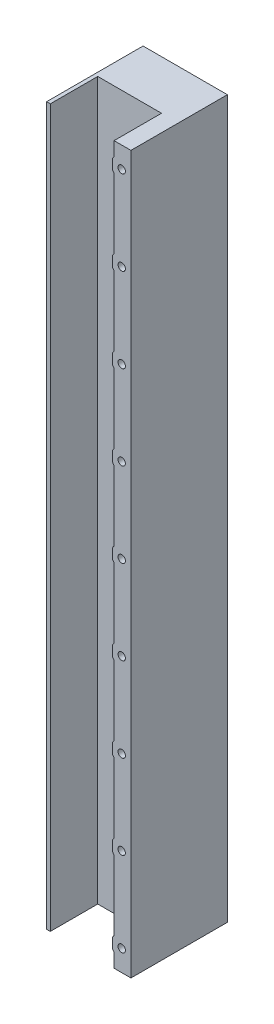
from build123d import *

# Parameters (mm, degrees)
PROFILE_SKETCH_W               = 16
PROFILE_SKETCH_H               = 18.3
PROFILE_EXTRUDE_DEPTH          = 136
POCKET_SKETCH_W                = 12.1
POCKET_SKETCH_H                = 9
POCKET_CUT_DEPTH               = 139.155311154
INDEX_HOLE_SKETCH_R            = 0.7
FIRST_INDEX_HOLE_CUT_DEPTH     = 8
INDEX_HOLE_REINFORCEMENT_REACH = 140.155
INDEX_HOLE_PATTERN_COUNT       = 9
INDEX_HOLE_PATTERN_PITCH       = 16


with BuildPart() as part:
    # Profile Sketch → Profile Extrude (new body)
    with BuildSketch(Plane(origin=(0.045617437, 0, -0.024209872), x_dir=(-1, 0, 0), z_dir=(0, 1, 0))):
        with Locations((8.045617437, -9.125790128)):
            Rectangle(PROFILE_SKETCH_W, PROFILE_SKETCH_H)
    extrude(amount=PROFILE_EXTRUDE_DEPTH)

    # Pocket Sketch → Pocket Cut (cut, through all)
    with BuildSketch(Plane(origin=(0, 0, 0), x_dir=(1, 0, 0), z_dir=(0, 1, 0))):
        with Locations((-9.25, 4.5)):
            Rectangle(POCKET_SKETCH_W, POCKET_SKETCH_H)
    extrude(amount=POCKET_CUT_DEPTH, mode=Mode.SUBTRACT)

    # Index Hole Sketch → First Index Hole Cut (cut)
    with BuildSketch(Plane.XY):
        with Locations((-1.75, 4)):
            Circle(INDEX_HOLE_SKETCH_R)
    first_index_hole_cut = extrude(amount=-FIRST_INDEX_HOLE_CUT_DEPTH, mode=Mode.SUBTRACT)

    # Index Hole Reinforcement Sketch → Index Hole Reinforcement (add, up to next)
    with BuildSketch(Plane.XY, mode=Mode.PRIVATE) as index_hole_reinforcement_sk1:
        with BuildLine():
            Line((-3.5, 4.968245837), (-3.5, 3.031754163))
            ThreePointArc((-3.5, 3.031754163), (-3.363031859, 2.817575279), (-3.2, 2.622502269))
            Line((-3.2, 2.622502269), (-3.2, 5.377497731))
            ThreePointArc((-3.2, 5.377497731), (-3.363031859, 5.182424721), (-3.5, 4.968245837))
        make_face()
    index_hole_reinforcement_tool1 = extrude(index_hole_reinforcement_sk1.sketch, amount=-INDEX_HOLE_REINFORCEMENT_REACH, mode=Mode.PRIVATE) - part.part
    index_hole_reinforcement = index_hole_reinforcement_tool1.solids().sort_by_distance((-3.34149, 4, 0))[0]
    add(index_hole_reinforcement)

    # Index Hole Pattern: First Index Hole Cut, Index Hole Reinforcement ×9
    with Locations(*[(0, i * INDEX_HOLE_PATTERN_PITCH, 0) for i in range(1, INDEX_HOLE_PATTERN_COUNT)]):
        add(first_index_hole_cut, mode=Mode.SUBTRACT)
        add(index_hole_reinforcement)


solid = part.part
